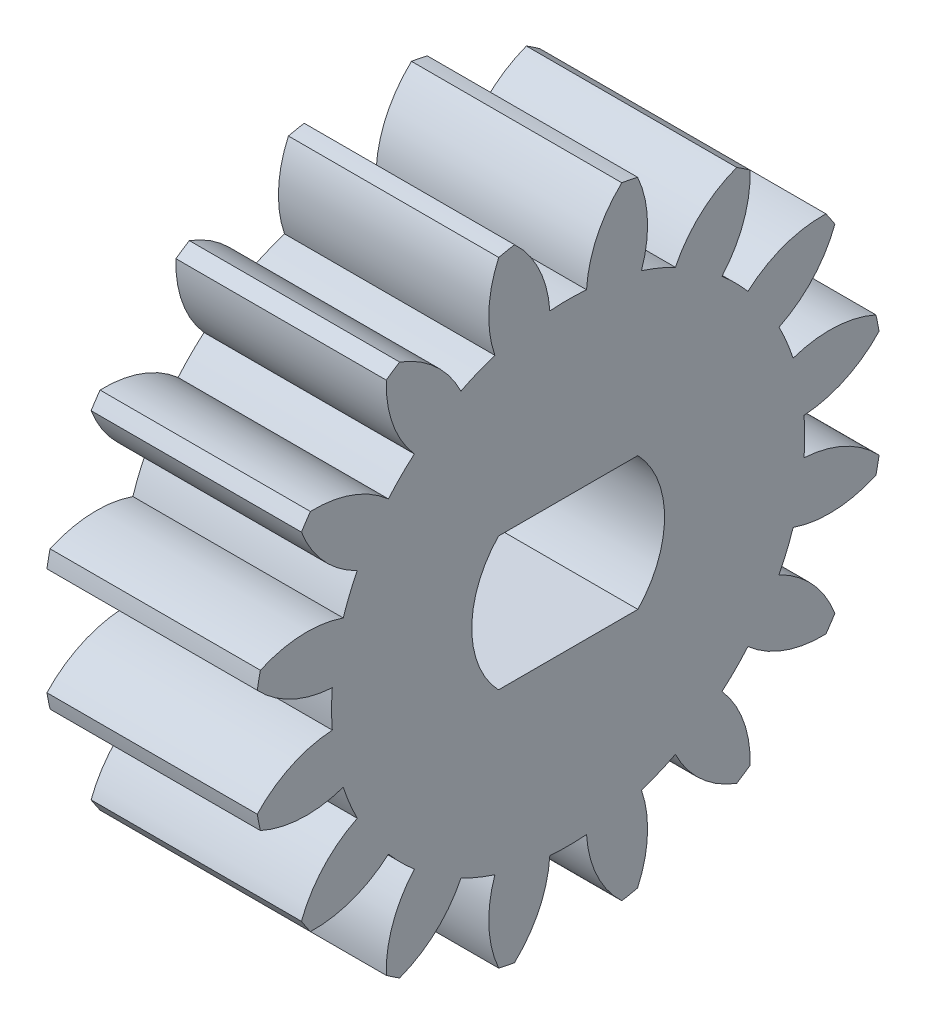
from build123d import *

# Parameters (mm, degrees)
BASPROSKE_W        = 6
BASPROSKE_H        = 9
TOOTHCUT_DEPTH     = 15.071247279
TEETHCUTS_COUNT    = 16
TEETHCUTS_ANGLE    = 337.5
CUT_EXTRUDE1_DEPTH = 13


with BuildPart() as part:
    # BasProSke → Base-Revolve (revolve)
    with BuildSketch(Plane(origin=(0, 0, 0), x_dir=(1, 0, 0), z_dir=(0, 1, 0))):
        with Locations((3, 4.5)):
            Rectangle(BASPROSKE_W, BASPROSKE_H)
    revolve(axis=Axis((-10, 0, 0), (1, 0, 0)))

    # TooCutSke → ToothCut (cut, through all)
    with BuildSketch(Plane(origin=(0, 0, 0), x_dir=(0, 0, -1), z_dir=(1, 0, 0))):
        with BuildLine():
            ThreePointArc((0.523792937, 6.728643397), (0, 6.749), (-0.523792937, 6.728643397))
            ThreePointArc((-0.523792937, 6.728643397), (-0.828704482, 7.90962059), (-1.553355277, 8.890721711))
            ThreePointArc((-1.553355277, 8.890721711), (0, 9.0254), (1.553355277, 8.890721711))
            ThreePointArc((1.553355277, 8.890721711), (0.828704482, 7.90962059), (0.523792937, 6.728643397))
        make_face()
    toothcut = extrude(amount=TOOTHCUT_DEPTH, mode=Mode.SUBTRACT)

    # TeethCuts: ToothCut ×16 about axis
    teethcuts_axis = Axis((-10, 0, 0), (1, 0, 0))
    for i in range(1, TEETHCUTS_COUNT):
        add(toothcut.rotate(teethcuts_axis, i * TEETHCUTS_ANGLE / (TEETHCUTS_COUNT - 1)), mode=Mode.SUBTRACT)

    # BorSke → Cut-Extrude1 (cut)
    with BuildSketch(Plane(origin=(0, 0, 0), x_dir=(0, 0, -1), z_dir=(1, 0, 0))):
        with BuildLine():
            Line((1.988089535, 1.9), (-1.988089535, 1.9))
            ThreePointArc((-1.988089535, 1.9), (-2.75, 0), (-1.988089535, -1.9))
            Line((-1.988089535, -1.9), (1.988089535, -1.9))
            ThreePointArc((1.988089535, -1.9), (2.552424947, -1.023536462), (2.75, 0))
            ThreePointArc((2.75, 0), (2.552424947, 1.023536462), (1.988089535, 1.9))
        make_face()
    extrude(amount=CUT_EXTRUDE1_DEPTH, mode=Mode.SUBTRACT)


solid = part.part
